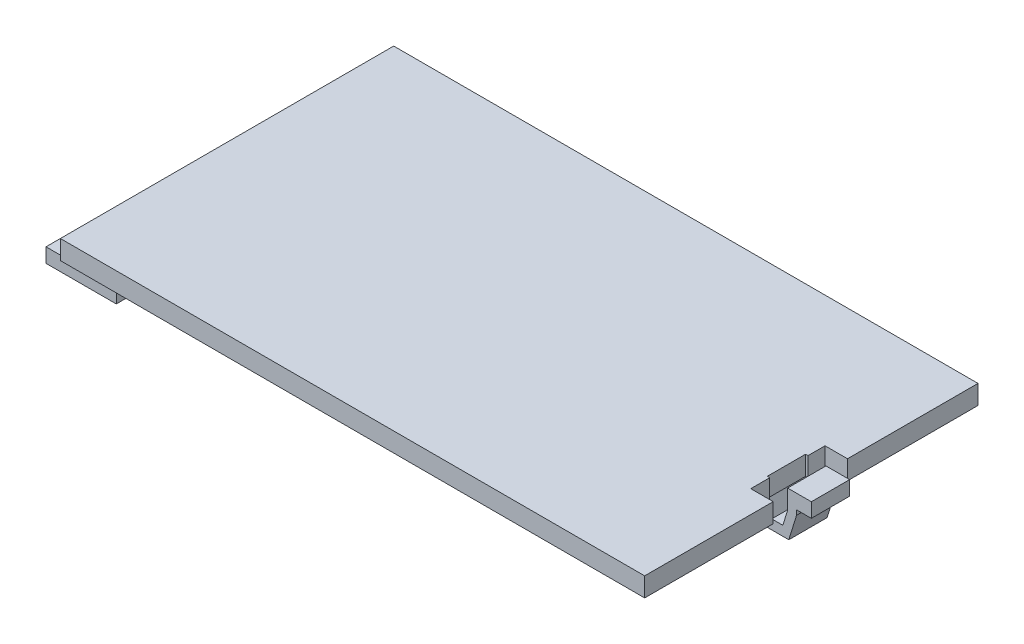
from build123d import *

# Parameters (mm, degrees)
SKETCH_1_W          = 61
SKETCH_1_H          = 34.8
EXTRUDE_1_DEPTH     = 2
SKETCH_2_W          = 7.338143312
SKETCH_2_H          = 2
EXTRUDE_2_DEPTH     = 1.5
SKETCH_3_W          = 2
SKETCH_3_H          = 4
EXTRUDE_3_DEPTH     = 1.5
EXTRUDE_4_DEPTH     = 4
CUT_EXTRUDE_1_DEPTH = 4
CUT_EXTRUDE_2_DEPTH = 2


with BuildPart() as part:
    # 草图1 → 凸台-拉伸1 (new body)
    with BuildSketch(Plane(origin=(0, 0, 0), x_dir=(1, 0, 0), z_dir=(0, 1, 0))):
        with Locations((30.5, 17.4)):
            Rectangle(SKETCH_1_W, SKETCH_1_H)
    extrude(amount=EXTRUDE_1_DEPTH)

    # 草图2 → 凸台-拉伸2 (add)
    with BuildSketch(Plane.XZ):
        with Locations((1.669071656, -1.5)):
            Rectangle(SKETCH_2_W, SKETCH_2_H)
        with Locations((1.669071656, -33.3)):
            Rectangle(SKETCH_2_W, SKETCH_2_H)
    extrude(amount=EXTRUDE_2_DEPTH)

    # 草图3 → 凸台-拉伸3 (add)
    with BuildSketch(Plane(origin=(0, 2, 0), x_dir=(1, 0, 0), z_dir=(0, 1, 0))):
        with Locations((62, 17.4)):
            Rectangle(SKETCH_3_W, SKETCH_3_H)
    extrude(amount=-EXTRUDE_3_DEPTH)

    # 草图5 → 凸台-拉伸4 (add)
    with BuildSketch(Plane.XY.offset(-15.4)):
        Polygon((59.571432726, -2.615990319), (58.310379478, -2.615990319), (57.551979039, 0), (57.551979039, 2), (61, 2), (61.455583574, 2), (61.455583574, 0), (60.646402895, -2.615990319), align=None)
    extrude(amount=-EXTRUDE_4_DEPTH)

    # 草图6 → 切除-拉伸1 (cut)
    with BuildSketch(Plane.XY.offset(-15.4)):
        Polygon((58.401311438, 0), (58.86980238, -1.615990319), (60.026919383, -1.615990319), (60.526779086, 0), (60.526779086, 2), (58.401311438, 2), align=None)
    extrude(amount=-CUT_EXTRUDE_1_DEPTH, mode=Mode.SUBTRACT)

    # 草图7 → 切除-拉伸2 (cut)
    with BuildSketch(Plane(origin=(0, 2, 0), x_dir=(1, 0, 0), z_dir=(0, 1, 0))):
        Polygon((58.656549503, 21.173440452), (61, 21.173440452), (61, 19.4), (60.526779086, 19.4), (60.526779086, 15.4), (61, 15.4), (61, 13.41884723), (58.656549503, 13.41884723), align=None)
    extrude(amount=-CUT_EXTRUDE_2_DEPTH, mode=Mode.SUBTRACT)


solid = part.part
